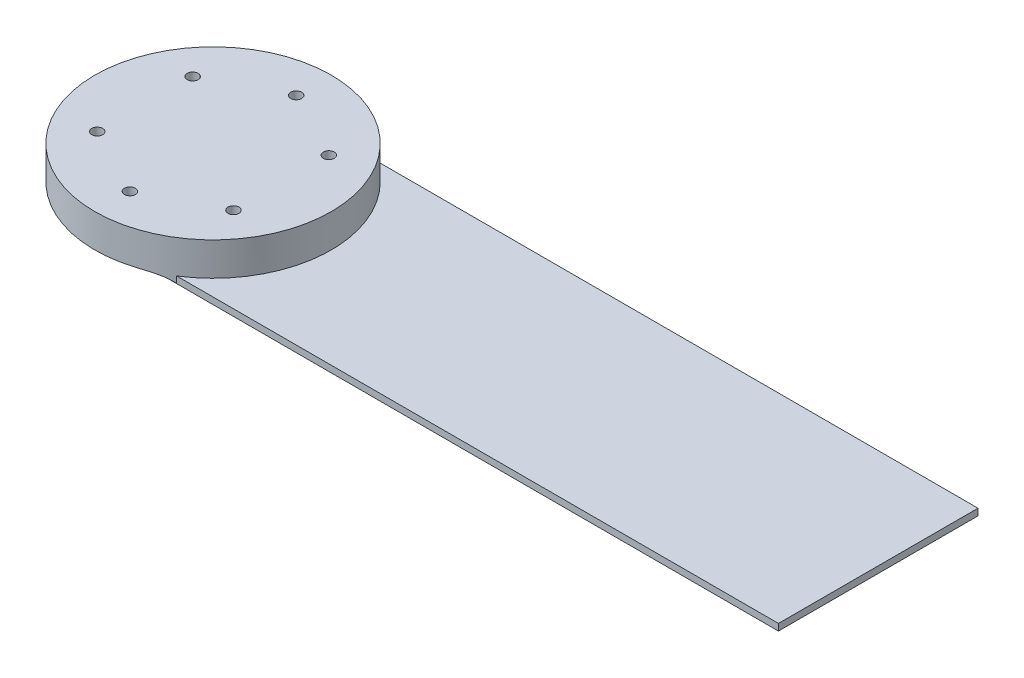
from build123d import *

# Parameters (mm, degrees)
BOSS_EXTRUDE1_DEPTH = 2
SKETCH3_R           = 35.55
BOSS_EXTRUDE2_DEPTH = 10
FILLET1_R           = 5
SKETCH4_R           = 1.65
CUT_EXTRUDE1_DEPTH  = 19


with BuildPart() as part:
    # Sketch2 → Boss-Extrude1 (new body)
    with BuildSketch(Plane(origin=(0, 0, 0), x_dir=(1, 0, 0), z_dir=(0, 1, 0))):
        with BuildLine():
            Line((0, 0), (200, 0))
            Line((200, 0), (200, -60))
            Line((200, -60), (0, -60))
            ThreePointArc((0, -60), (-30, -30), (0, 0))
        make_face()
    extrude(amount=BOSS_EXTRUDE1_DEPTH)

    # Sketch3 → Boss-Extrude2 (add)
    with BuildSketch(Plane(origin=(0, 2, 0), x_dir=(1, 0, 0), z_dir=(0, 1, 0))):
        with Locations(Location((0, -30, 0), (0, 0, 57.552333234))):
            Circle(SKETCH3_R)
    extrude(amount=BOSS_EXTRUDE2_DEPTH)

    # Fillet1
    # the kernel refuses this fillet: 5 mm, written as the material it adds along each edge
    with BuildSketch(Plane(origin=(0, 2, 0), x_dir=(0, -1, 0), z_dir=(1, 0, 0))) as fillet1_piece_1_section:
        with BuildLine():
            CenterArc((5, 4), FILLET1_R, 180, 53.130102354)
            Line((0, 4), (0, 0))
            Line((0, 0), (2, 0))
        make_face()
    fillet1_piece_1 = extrude(amount=29.07360742, mode=Mode.PRIVATE)
    fillet1_piece_1 = fillet1_piece_1 & Plane(origin=(0, 2, 30), x_dir=(0.5365290413395907, 0, -0.8438818565410799), z_dir=(0, -1, 0)) * Cylinder(35.55, 75, mode=Mode.PRIVATE)
    add(fillet1_piece_1)
    with BuildSketch(Plane(origin=(29.07360742, 2, 60), x_dir=(0, 0, 1), z_dir=(-1, 0, 0))) as fillet1_piece_2_section:
        with BuildLine():
            CenterArc((4, -5), FILLET1_R, 90, 53.130102354)
            Line((0, -2), (0, 0))
            Line((0, 0), (4, 0))
        make_face()
    fillet1_piece_2 = extrude(amount=29.07360742, mode=Mode.PRIVATE)
    fillet1_piece_2 = fillet1_piece_2 & Plane(origin=(0, 2, 30), x_dir=(0.5365290413395907, 0, -0.8438818565410799), z_dir=(0, -1, 0)) * Cylinder(35.55, 75, mode=Mode.PRIVATE)
    add(fillet1_piece_2)
    with BuildSketch(Plane(origin=(0, 2, 30), x_dir=(0, 0, 1), z_dir=(1, 0, 0))) as fillet1_piece_3:
        with BuildLine():
            CenterArc((34, 5), FILLET1_R, 216.869897646, 53.130102354)
            Line((34, 0), (30, 0))
            Line((30, 0), (30, 2))
        make_face()
    revolve(axis=Axis((0, 2, 30), (0, -1, 0)), revolution_arc=180)

    # Sketch4 → Cut-Extrude1 (cut)
    with BuildSketch(Plane(origin=(0, 12, 0), x_dir=(1, 0, 0), z_dir=(0, 1, 0))):
        with Locations(Location((0, -5, 0), (0, 0, 270))):
            Circle(SKETCH4_R)
        with Locations(Location((0, -55, 0), (0, 0, 270))):
            Circle(SKETCH4_R)
        with Locations(Location((-20.478801107, -15.660589091, 0), (0, 0, 270))):
            Circle(SKETCH4_R)
        with Locations(Location((-20.478801107, -44.339410909, 0), (0, 0, 270))):
            Circle(SKETCH4_R)
        with Locations(Location((20.478801107, -15.660589091, 0), (0, 0, 270))):
            Circle(SKETCH4_R)
        with Locations(Location((20.478801107, -44.339410909, 0), (0, 0, 270))):
            Circle(SKETCH4_R)
    extrude(amount=-CUT_EXTRUDE1_DEPTH, mode=Mode.SUBTRACT)


solid = part.part
